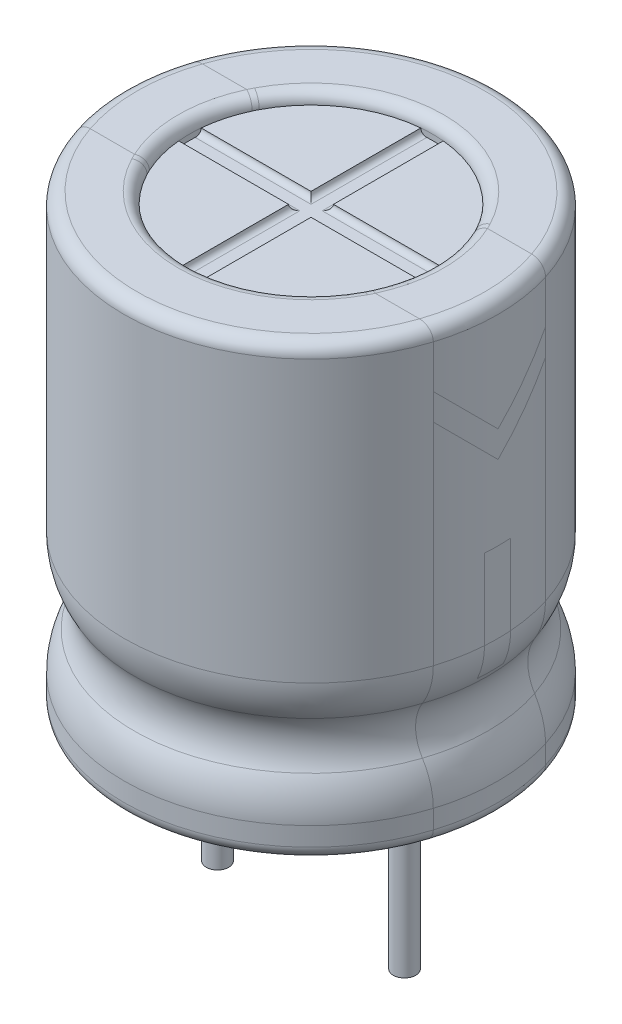
from build123d import *

# Parameters (mm, degrees)
SKETCH_2_R          = 3.25
CUT_EXTRUDE_1_DEPTH = 0.3
CUT_EXTRUDE_2_DEPTH = 0.15
FILLET_1_R          = 0.35
FILLET_2_R          = 2
CUT_EXTRUDE_START   = -0.25
SKETCH_4_R          = 3.25
CUT_EXTRUDE_3_DEPTH = 0.25
SKETCH_5_R          = 0.3
EXTRUDE_1_DEPTH     = 5
FILLET_3_R          = 0.15
FILLET_4_R          = 0.3
FILLET_5_R          = 0.25


with BuildPart() as part:
    # Эскиз1 → Повернуть2 (revolve)
    with BuildSketch(Plane.XY, mode=Mode.PRIVATE) as revolve_2_sk:
        with BuildLine():
            Line((0, 0), (-5, 0))
            Line((-5, 0), (-5, 1.539531364))
            ThreePointArc((-5, 1.539531364), (-4.55, 2.5), (-5, 3.460468636))
            Line((-5, 3.460468636), (-5, 12))
            Line((-5, 12), (0, 12))
            Line((0, 12), (0, 0))
        make_face()
    revolve(revolve_2_sk.sketch.rotate(Axis((0, 47.03836845, 0), (0, -1, 0)), 270), axis=Axis((0, 47.03836845, 0), (0, -1, 0)))

    # Эскиз2 → Вырез-Вытянуть1 (cut)
    with BuildSketch(Plane(origin=(0, 12, 0), x_dir=(1, 0, 0), z_dir=(0, 1, 0))):
        with Locations(Location((0, 0, 0), (0, 0, 270))):
            Circle(SKETCH_2_R)
    extrude(amount=-CUT_EXTRUDE_1_DEPTH, mode=Mode.SUBTRACT)

    # Эскиз3 → Вырез-Вытянуть2 (cut)
    with BuildSketch(Plane(origin=(0, 11.7, 0), x_dir=(1, 0, 0), z_dir=(0, 1, 0))):
        with BuildLine():
            Line((-0.3, 3.236124225), (-0.3, 0.3))
            Line((-0.3, 0.3), (-3.236124225, 0.3))
            ThreePointArc((-3.236124225, 0.3), (-3.25, 0), (-3.236124225, -0.3))
            Line((-3.236124225, -0.3), (-0.3, -0.3))
            Line((-0.3, -0.3), (-0.3, -3.236124225))
            ThreePointArc((-0.3, -3.236124225), (0, -3.25), (0.3, -3.236124225))
            Line((0.3, -3.236124225), (0.3, -0.3))
            Line((0.3, -0.3), (3.236124225, -0.3))
            ThreePointArc((3.236124225, -0.3), (3.25, 0), (3.236124225, 0.3))
            Line((3.236124225, 0.3), (0.3, 0.3))
            Line((0.3, 0.3), (0.3, 3.236124225))
            ThreePointArc((0.3, 3.236124225), (0, 3.25), (-0.3, 3.236124225))
        make_face()
    extrude(amount=-CUT_EXTRUDE_2_DEPTH, mode=Mode.SUBTRACT)

    # Скругление1
    fillet_1_edges = [part.edges().sort_by_distance(p)[0] for p in [
        (0, 0, -5),
        (0, 12, -5),
    ]]
    fillet(fillet_1_edges, radius=FILLET_1_R)

    # Скругление2
    fillet_2_edges = [part.edges().sort_by_distance(p)[0] for p in [
        (0, 1.539531364, -5),
        (0, 3.460468636, -5),
    ]]
    fillet(fillet_2_edges, radius=FILLET_2_R)

    # Эскиз4 → Вырез-Вытянуть3 (cut)
    with BuildSketch(Plane.XZ.offset(CUT_EXTRUDE_START)):
        with Locations(Location((0, 0, 0), (0, 0, 90))):
            Circle(SKETCH_4_R)
    extrude(amount=CUT_EXTRUDE_3_DEPTH, mode=Mode.SUBTRACT)

    # Эскиз5 → Бобышка-Вытянуть1 (add)
    with BuildSketch(Plane.XZ.offset(-0.25)):
        with Locations(Location((-2.5, 0, 0), (0, 0, 270))):
            Circle(SKETCH_5_R)
        with Locations(Location((2.5, 0, 0), (0, 0, 90))):
            Circle(SKETCH_5_R)
    extrude(amount=EXTRUDE_1_DEPTH)

    # Скругление3
    fillet_3_edges = [part.edges().sort_by_distance(p)[0] for p in [
        (0.3, 11.55, -1.768062113),
        (-1.768062113, 11.55, 0.3),
        (1.768062113, 11.55, 0.3),
        (0.3, 11.55, 1.768062113),
        (-0.3, 11.55, 1.768062113),
        (1.768062113, 11.55, -0.3),
        (-0.3, 11.55, -1.768062113),
        (-1.768062113, 11.55, -0.3),
    ]]
    fillet(fillet_3_edges, radius=FILLET_3_R - 0.0001)  # a hair under: the kernel refuses the full size

    # Скругление4
    fillet_4_edges = [part.edges().sort_by_distance(p)[0] for p in [
        (0, 12, -3.25),
    ]]
    fillet(fillet_4_edges, radius=FILLET_4_R - 0.0001)  # a hair under: the kernel refuses the full size

    # Скругление5
    fillet_5_edges = [part.edges().sort_by_distance(p)[0] for p in [
        (0, 0, -3.25),
    ]]
    fillet(fillet_5_edges, radius=FILLET_5_R - 0.0001)  # a hair under: the kernel refuses the full size


solid = part.part
